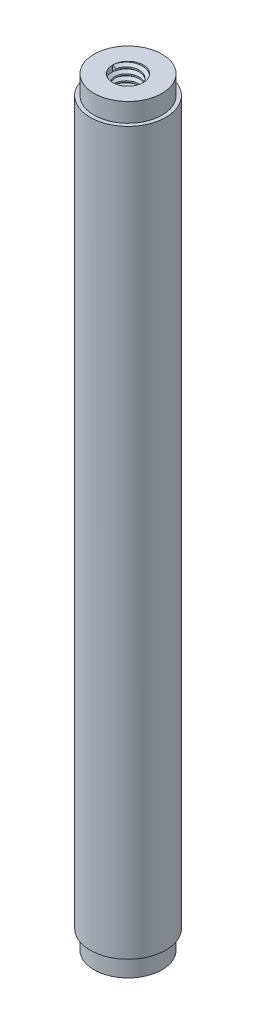
from build123d import *
from build123d.topology import SkipClean

# Parameters (mm, degrees)
SKETCH1_R           = 5
BOSS_EXTRUDE1_DEPTH = 100.5
SKETCH5_R           = 2.025
CUT_EXTRUDE1_DEPTH  = 25.4
THREAD1_PITCH       = 0.79375
CUT_EXTRUDE2_START  = -25.4
SKETCH19_R          = 2.025
CUT_EXTRUDE2_DEPTH  = 25.4
THREAD2_PITCH       = 0.79375
SKETCH24_R          = 5
SKETCH24_R_2        = 4.5
CUT_EXTRUDE3_DEPTH  = 2.5
CUT_EXTRUDE4_START  = -2.5
SKETCH25_R          = 5
SKETCH25_R_2        = 4.5
CUT_EXTRUDE4_DEPTH  = 2.5


with BuildPart() as part:
    # Sketch1 → Boss-Extrude1 (new body)
    with BuildSketch(Plane(origin=(0, 0, 0), x_dir=(1, 0, 0), z_dir=(0, 1, 0))):
        with Locations(Location((0, 0, 0), (0, 0, 270))):
            Circle(SKETCH1_R)
    extrude(amount=BOSS_EXTRUDE1_DEPTH)

    # Sketch5 → Cut-Extrude1 (cut)
    with BuildSketch(Plane.XZ):
        with Locations(Location((0, 0, 0), (0, 0, 270))):
            Circle(SKETCH5_R)
    extrude(amount=-CUT_EXTRUDE1_DEPTH, mode=Mode.SUBTRACT)

    # Thread1: arcs per turn and ends read off the stored shape
    # Thread1: the profile of Thread Profile3 profile screwed along a right-hand helix through 48 turns, 8 arcs to a turn; built about Z, then put on its axis
    thread1_z = Axis((0, 0, 0), (0, 0, 1))
    thread1_corners = [(2.0253, 0, -0.000173205), (2.0253, 0, 0.694704453), (1.595370212, 0, 0.446484374), (1.595370212, 0, 0.248046874)]
    with BuildLine(mode=Mode.PRIVATE) as thread1_profile:
        Line(thread1_corners[0], thread1_corners[1])
        Line(thread1_corners[1], thread1_corners[2])
        Line(thread1_corners[2], thread1_corners[3])
        Line(thread1_corners[3], thread1_corners[0])
    thread1_cap = Face(thread1_profile.wire())
    thread1_turn_angles = [0, 22.5, 45, 67.5, 90, 112.5, 135, 157.5, 180, 202.5, 225, 247.5, 270, 292.5, 315, 337.5, 360]
    thread1_turn_weights = [1, 0.9238795325112867, 1, 0.9238795325112867, 1, 0.9238795325112867, 1, 0.9238795325112867, 1, 0.9238795325112867, 1, 0.9238795325112867, 1, 0.9238795325112867, 1, 0.9238795325112867, 1]
    thread1_turn_rails = [Edge.make_bspline([Vector(p[0], p[1], 0).rotate(thread1_z, thread1_turn_angles[k]) / thread1_turn_weights[k] + Vector(0, 0, p[2] + THREAD1_PITCH * thread1_turn_angles[k] / 360) for k in range(17)], [0, 0, 0, 1, 1, 2, 2, 3, 3, 4, 4, 5, 5, 6, 6, 7, 7, 8, 8, 8], 2, thread1_turn_weights) for p in thread1_corners]
    thread1_turn_sides = [Face.make_surface_from_curves(thread1_turn_rails[p[0]], thread1_turn_rails[p[1]]) for p in [(0, 1), (1, 2), (2, 3), (3, 0)]]
    thread1 = Plane(origin=(0, 0, 0), x_dir=(1, 0, 0), z_dir=(0, 1, 0)) * Solid(Shell([*[p.moved(Location((0, 0, THREAD1_PITCH * i))) for i in range(48) for p in thread1_turn_sides], thread1_cap, thread1_cap.rotate(thread1_z, 17280).moved(Location((0, 0, THREAD1_PITCH * 17280 / 360)))]))
    add(thread1)

    # Sketch19 → Cut-Extrude2 (cut)
    with BuildSketch(Plane(origin=(0, 100.5, 0), x_dir=(1, 0, 0), z_dir=(0, 1, 0)).offset(CUT_EXTRUDE2_START)):
        with Locations(Location((0, 0, 0), (0, 0, 270))):
            Circle(SKETCH19_R)
    extrude(amount=CUT_EXTRUDE2_DEPTH, mode=Mode.SUBTRACT)

    # Thread2: arcs per turn and ends read off the stored shape
    # Thread2: the profile of Thread Profile4 profile screwed along a right-hand helix through 48 turns, 8 arcs to a turn; built about Z, then put on its axis
    thread2_z = Axis((0, 0, 0), (0, 0, 1))
    thread2_corners = [(2.0253, 0, -0.000173205), (2.0253, 0, 0.694704453), (1.595370212, 0, 0.446484374), (1.595370212, 0, 0.248046874)]
    with BuildLine(mode=Mode.PRIVATE) as thread2_profile:
        Line(thread2_corners[0], thread2_corners[1])
        Line(thread2_corners[1], thread2_corners[2])
        Line(thread2_corners[2], thread2_corners[3])
        Line(thread2_corners[3], thread2_corners[0])
    thread2_cap = Face(thread2_profile.wire())
    thread2_turn_angles = [0, 22.5, 45, 67.5, 90, 112.5, 135, 157.5, 180, 202.5, 225, 247.5, 270, 292.5, 315, 337.5, 360]
    thread2_turn_weights = [1, 0.9238795325112867, 1, 0.9238795325112867, 1, 0.9238795325112867, 1, 0.9238795325112867, 1, 0.9238795325112867, 1, 0.9238795325112867, 1, 0.9238795325112867, 1, 0.9238795325112867, 1]
    thread2_turn_rails = [Edge.make_bspline([Vector(p[0], p[1], 0).rotate(thread2_z, thread2_turn_angles[k]) / thread2_turn_weights[k] + Vector(0, 0, p[2] + THREAD2_PITCH * thread2_turn_angles[k] / 360) for k in range(17)], [0, 0, 0, 1, 1, 2, 2, 3, 3, 4, 4, 5, 5, 6, 6, 7, 7, 8, 8, 8], 2, thread2_turn_weights) for p in thread2_corners]
    thread2_turn_sides = [Face.make_surface_from_curves(thread2_turn_rails[p[0]], thread2_turn_rails[p[1]]) for p in [(0, 1), (1, 2), (2, 3), (3, 0)]]
    thread2 = Plane(origin=(0, 100.5, 0), x_dir=(-1, 0, 0), z_dir=(0, -1, 0)) * Solid(Shell([*[p.moved(Location((0, 0, THREAD2_PITCH * i))) for i in range(48) for p in thread2_turn_sides], thread2_cap, thread2_cap.rotate(thread2_z, 17280).moved(Location((0, 0, THREAD2_PITCH * 17280 / 360)))]))
    add(thread2)

    # Sketch24 → Cut-Extrude3 (cut)
    with SkipClean():  # the faces are left unmerged after this step: merging them gives an invalid solid
        with BuildSketch(Plane(origin=(0, 0, 0), x_dir=(-1, 0, 0), z_dir=(0, -1, 0))):
            with Locations(Location((0, 0, 0), (0, 0, 90))):
                Circle(SKETCH24_R)
            with Locations(Location((0, 0, 0), (0, 0, 90))):
                Circle(SKETCH24_R_2, mode=Mode.SUBTRACT)
        extrude(amount=-CUT_EXTRUDE3_DEPTH, mode=Mode.SUBTRACT)

    # Sketch25 → Cut-Extrude4 (cut)
    with SkipClean():  # the faces are left unmerged after this step: merging them gives an invalid solid
        with BuildSketch(Plane(origin=(0, 100.5, 0), x_dir=(1, 0, 0), z_dir=(0, 1, 0)).offset(CUT_EXTRUDE4_START)):
            with Locations(Location((0, 0, 0), (0, 0, 90))):
                Circle(SKETCH25_R)
            with Locations(Location((0, 0, 0), (0, 0, 90))):
                Circle(SKETCH25_R_2, mode=Mode.SUBTRACT)
        extrude(amount=CUT_EXTRUDE4_DEPTH, mode=Mode.SUBTRACT)


solid = part.part
